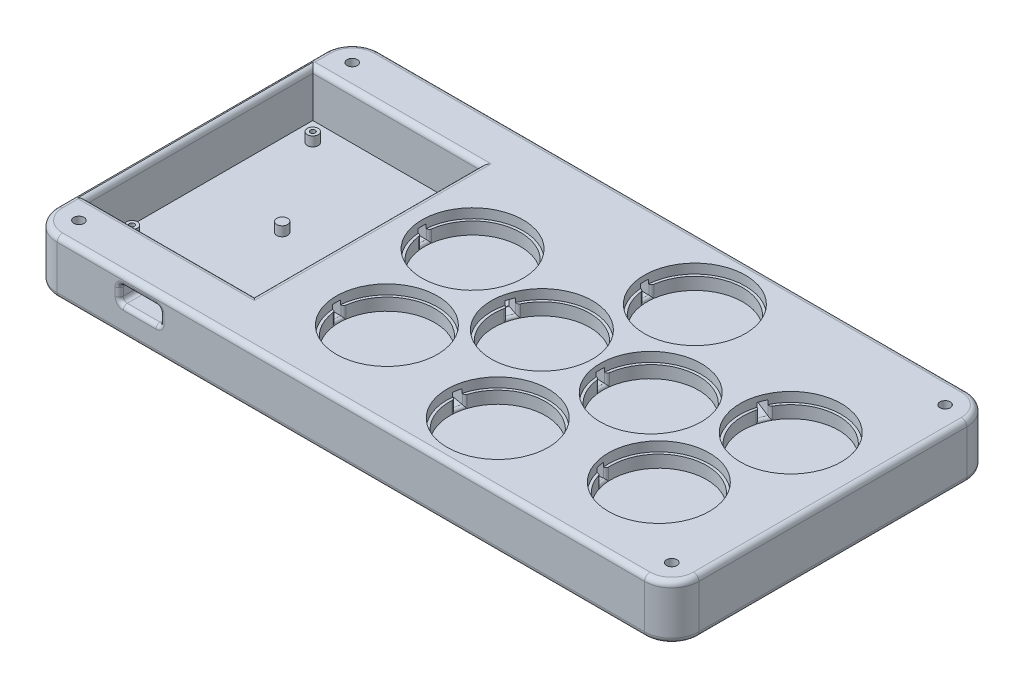
from build123d import *

# Parameters (mm, degrees)
SKETCH1_W                = 236
SKETCH1_H                = 118.5
SKETCH1_W_2              = 230
SKETCH1_H_2              = 112.5
SKETCH1_R                = 17.6
SKETCH1_W_3              = 61
SKETCH1_H_3              = 82.5
SKETCH1_W_4              = 61.6
SKETCH1_H_4              = 83.1
BOSS_EXTRUDE1_DEPTH      = 5
SKETCH1_3_W              = 236
SKETCH1_3_H              = 118.5
SKETCH1_3_W_2            = 230
SKETCH1_3_H_2            = 112.5
SKETCH1_3_R              = 17.6
SKETCH1_3_W_3            = 61.6
SKETCH1_3_H_3            = 83.1
BOSS_EXTRUDE2_DEPTH      = 15
CUT_EXTRUDE2_START       = -2
SKETCH1_5_W              = 61
SKETCH1_5_H              = 82.5
SKETCH1_5_R              = 17.6
SKETCH1_5_W_2            = 61.6
SKETCH1_5_H_2            = 83.1
CUT_EXTRUDE2_DEPTH       = 2
CUT_EXTRUDE3_DEPTH       = 1
CUT_EXTRUDE3_DEPTH_BACK  = 4
CUT_EXTRUDE4_REACH       = 219.976
SKETCH3_W                = 15
SKETCH3_H                = 6
SKETCH4_R                = 2
SKETCH4_R_2              = 0.925
BOSS_EXTRUDE3_DEPTH      = 3.5
BOSS_EXTRUDE4_DEPTH      = 7
BOSS_EXTRUDE4_DEPTH_BACK = 2
SKETCH1_6_R              = 17.6
FILLET1_R                = 1
FILLET2_R                = 1.5
SKETCH7_R                = 1.9
CUT_EXTRUDE5_DEPTH       = 6
FILLET3_R                = 10
FILLET4_R                = 2
CUT_EXTRUDE6_START       = -3.5
SKETCH8_R                = 18.6
SKETCH8_R_2              = 17.6
CUT_EXTRUDE6_DEPTH       = 3.5


# Some blends are built 0.0001 mm under size
with BuildPart() as part:
    # Sketch1 → Boss-Extrude1 (new body)
    # profile 1 of 12: a face of its own
    with BuildSketch(Plane(origin=(0, 0, 0), x_dir=(1, 0, 0), z_dir=(0, 1, 0))):
        with Locations((64.335496373, 41.57608502)):
            Rectangle(SKETCH1_W, SKETCH1_H)
        with Locations((64.335496373, 41.57608502)):
            Rectangle(SKETCH1_W_2, SKETCH1_H_2, mode=Mode.SUBTRACT)
    # profile 2 of 12: a face of its own
    with BuildSketch(Plane(origin=(0, 0, 0), x_dir=(1, 0, 0), z_dir=(0, 1, 0))):
        with Locations((64.335496373, 41.57608502)):
            Rectangle(SKETCH1_W_2, SKETCH1_H_2)
        with Locations((95.335496373, 77.82608502)):
            Circle(SKETCH1_R, mode=Mode.SUBTRACT)
        with Locations((153.835496373, 54.57608502)):
            Circle(SKETCH1_R, mode=Mode.SUBTRACT)
        with Locations((95.335496373, 5.32608502)):
            Circle(SKETCH1_R, mode=Mode.SUBTRACT)
        with Locations((115.335496373, 41.57608502)):
            Circle(SKETCH1_R, mode=Mode.SUBTRACT)
        with Locations((75.335496373, 41.57608502)):
            Circle(SKETCH1_R, mode=Mode.SUBTRACT)
        with Locations((145.335496373, 14.57608502)):
            Circle(SKETCH1_R, mode=Mode.SUBTRACT)
        with Locations((45.335496373, 14.57608502)):
            Circle(SKETCH1_R, mode=Mode.SUBTRACT)
        with Locations((36.835496373, 54.57608502)):
            Circle(SKETCH1_R, mode=Mode.SUBTRACT)
        with Locations((-19.664503627, 41.57608502)):
            Rectangle(SKETCH1_W_3, SKETCH1_H_3, mode=Mode.SUBTRACT)
    # profile 3 of 12: a face of its own
    with BuildSketch(Plane(origin=(0, 0, 0), x_dir=(1, 0, 0), z_dir=(0, 1, 0))):
        with Locations((-19.664503627, 41.57608502)):
            Rectangle(SKETCH1_W_3, SKETCH1_H_3)
    # profile 4 of 12: a face of its own
    with BuildSketch(Plane(origin=(0, 0, 0), x_dir=(1, 0, 0), z_dir=(0, 1, 0))):
        with Locations((36.835496373, 54.57608502)):
            Circle(SKETCH1_R)
    # profile 5 of 12: a face of its own
    with BuildSketch(Plane(origin=(0, 0, 0), x_dir=(1, 0, 0), z_dir=(0, 1, 0))):
        with Locations((45.335496373, 14.57608502)):
            Circle(SKETCH1_R)
    # profile 6 of 12: a face of its own
    with BuildSketch(Plane(origin=(0, 0, 0), x_dir=(1, 0, 0), z_dir=(0, 1, 0))):
        with Locations((75.335496373, 41.57608502)):
            Circle(SKETCH1_R)
    # profile 7 of 12: a face of its own
    with BuildSketch(Plane(origin=(0, 0, 0), x_dir=(1, 0, 0), z_dir=(0, 1, 0))):
        with Locations((95.335496373, 77.82608502)):
            Circle(SKETCH1_R)
    # profile 8 of 12: a face of its own
    with BuildSketch(Plane(origin=(0, 0, 0), x_dir=(1, 0, 0), z_dir=(0, 1, 0))):
        with Locations((115.335496373, 41.57608502)):
            Circle(SKETCH1_R)
    # profile 9 of 12: a face of its own
    with BuildSketch(Plane(origin=(0, 0, 0), x_dir=(1, 0, 0), z_dir=(0, 1, 0))):
        with Locations((153.835496373, 54.57608502)):
            Circle(SKETCH1_R)
    # profile 10 of 12: a face of its own
    with BuildSketch(Plane(origin=(0, 0, 0), x_dir=(1, 0, 0), z_dir=(0, 1, 0))):
        with Locations((145.335496373, 14.57608502)):
            Circle(SKETCH1_R)
    # profile 11 of 12: a face of its own
    with BuildSketch(Plane(origin=(0, 0, 0), x_dir=(1, 0, 0), z_dir=(0, 1, 0))):
        with Locations((95.335496373, 5.32608502)):
            Circle(SKETCH1_R)
    # profile 12 of 12: a face of its own
    with BuildSketch(Plane(origin=(0, 0, 0), x_dir=(1, 0, 0), z_dir=(0, 1, 0))):
        with Locations((-19.664503627, 41.57608502)):
            Rectangle(SKETCH1_W_4, SKETCH1_H_4)
    extrude(amount=-BOSS_EXTRUDE1_DEPTH)

    # Sketch1<3> → Boss-Extrude2 (add)
    # profile 1 of 2: a face of its own
    with BuildSketch(Plane(origin=(0, 0, 0), x_dir=(1, 0, 0), z_dir=(0, 1, 0))):
        with Locations((64.335496373, 41.57608502)):
            Rectangle(SKETCH1_3_W, SKETCH1_3_H)
        with Locations((64.335496373, 41.57608502)):
            Rectangle(SKETCH1_3_W_2, SKETCH1_3_H_2, mode=Mode.SUBTRACT)
    # profile 2 of 2: a face of its own
    with BuildSketch(Plane(origin=(0, 0, 0), x_dir=(1, 0, 0), z_dir=(0, 1, 0))):
        with Locations((64.335496373, 41.57608502)):
            Rectangle(SKETCH1_3_W_2, SKETCH1_3_H_2)
        with Locations(Location((95.335496373, 77.82608502, 0), (0, 0, 270))):
            Circle(SKETCH1_3_R, mode=Mode.SUBTRACT)
        with Locations(Location((153.835496373, 54.57608502, 0), (0, 0, 270))):
            Circle(SKETCH1_3_R, mode=Mode.SUBTRACT)
        with Locations(Location((95.335496373, 5.32608502, 0), (0, 0, 270))):
            Circle(SKETCH1_3_R, mode=Mode.SUBTRACT)
        with Locations(Location((115.335496373, 41.57608502, 0), (0, 0, 270))):
            Circle(SKETCH1_3_R, mode=Mode.SUBTRACT)
        with Locations(Location((75.335496373, 41.57608502, 0), (0, 0, 270))):
            Circle(SKETCH1_3_R, mode=Mode.SUBTRACT)
        with Locations(Location((145.335496373, 14.57608502, 0), (0, 0, 270))):
            Circle(SKETCH1_3_R, mode=Mode.SUBTRACT)
        with Locations(Location((45.335496373, 14.57608502, 0), (0, 0, 270))):
            Circle(SKETCH1_3_R, mode=Mode.SUBTRACT)
        with Locations(Location((36.835496373, 54.57608502, 0), (0, 0, 270))):
            Circle(SKETCH1_3_R, mode=Mode.SUBTRACT)
        with Locations((-19.664503627, 41.57608502)):
            Rectangle(SKETCH1_3_W_3, SKETCH1_3_H_3, mode=Mode.SUBTRACT)
    extrude(amount=BOSS_EXTRUDE2_DEPTH)

    # Sketch1<5> → Cut-Extrude2 (cut)
    with BuildSketch(Plane(origin=(0, 0, 0), x_dir=(1, 0, 0), z_dir=(0, 1, 0)).offset(CUT_EXTRUDE2_START)):
        with Locations((-19.664503627, 41.57608502)):
            Rectangle(SKETCH1_5_W, SKETCH1_5_H)
        with Locations(Location((36.835496373, 54.57608502, 0), (0, 0, 270))):
            Circle(SKETCH1_5_R)
        with Locations(Location((45.335496373, 14.57608502, 0), (0, 0, 270))):
            Circle(SKETCH1_5_R)
        with Locations(Location((75.335496373, 41.57608502, 0), (0, 0, 270))):
            Circle(SKETCH1_5_R)
        with Locations(Location((95.335496373, 77.82608502, 0), (0, 0, 270))):
            Circle(SKETCH1_5_R)
        with Locations(Location((115.335496373, 41.57608502, 0), (0, 0, 270))):
            Circle(SKETCH1_5_R)
        with Locations(Location((153.835496373, 54.57608502, 0), (0, 0, 270))):
            Circle(SKETCH1_5_R)
        with Locations(Location((145.335496373, 14.57608502, 0), (0, 0, 270))):
            Circle(SKETCH1_5_R)
        with Locations(Location((95.335496373, 5.32608502, 0), (0, 0, 270))):
            Circle(SKETCH1_5_R)
        with Locations((-19.664503627, 41.57608502)):
            Rectangle(SKETCH1_5_W_2, SKETCH1_5_H_2)
    extrude(amount=CUT_EXTRUDE2_DEPTH, mode=Mode.SUBTRACT)

    # Sketch2 → Cut-Extrude3 (cut, two sides: drawn at the far end of the back side and taken through both)
    with BuildSketch(Plane(origin=(0, 12, 0), x_dir=(1, 0, 0), z_dir=(0, 1, 0)).offset(-CUT_EXTRUDE3_DEPTH_BACK)):
        with BuildLine():
            Line((11.135496373, 79.32608502), (11.135496373, 76.32608502))
            Line((11.135496373, 76.32608502), (77.799533325, 76.32608502))
            ThreePointArc((77.799533325, 76.32608502), (77.735496373, 77.82608502), (77.799533325, 79.32608502))
            Line((77.799533325, 79.32608502), (11.135496373, 79.32608502))
        make_face()
        with BuildLine():
            ThreePointArc((19.299533325, 53.07608502), (19.235496373, 54.57608502), (19.299533325, 56.07608502))
            Line((19.299533325, 56.07608502), (11.135496373, 56.07608502))
            Line((11.135496373, 56.07608502), (11.135496373, 53.07608502))
            Line((11.135496373, 53.07608502), (19.299533325, 53.07608502))
        make_face()
        with BuildLine():
            Line((59.200999236, 48.607301283), (53.929743667, 50.38720576))
            ThreePointArc((53.929743667, 50.38720576), (53.510540122, 48.945550767), (52.96999351, 47.544868758))
            Line((52.96999351, 47.544868758), (58.241249079, 45.76496428))
            ThreePointArc((58.241249079, 45.76496428), (58.660452624, 47.206619273), (59.200999236, 48.607301283))
        make_face()
        with BuildLine():
            Line((97.799533325, 43.07608502), (92.87145942, 43.07608502))
            ThreePointArc((92.87145942, 43.07608502), (92.919479847, 42.326768164), (92.935496373, 41.57608502))
            ThreePointArc((92.935496373, 41.57608502), (92.919479847, 40.825401876), (92.87145942, 40.07608502))
            Line((92.87145942, 40.07608502), (97.799533325, 40.07608502))
            ThreePointArc((97.799533325, 40.07608502), (97.735496373, 41.57608502), (97.799533325, 43.07608502))
        make_face()
        with BuildLine():
            ThreePointArc((112.185601477, 72.743373343), (111.691107335, 71.325778099), (111.077594615, 69.955485111))
            Line((111.077594615, 69.955485111), (136.985391269, 59.658796697))
            ThreePointArc((136.985391269, 59.658796697), (137.479885411, 61.076391941), (138.093398131, 62.446684929))
            Line((138.093398131, 62.446684929), (112.185601477, 72.743373343))
        make_face()
        with BuildLine():
            Line((127.819258216, 12.861033763), (112.305994931, 9.991080055))
            ThreePointArc((112.305994931, 9.991080055), (112.641833201, 8.527757333), (112.85173453, 7.041136278))
            Line((112.85173453, 7.041136278), (128.364997814, 9.911089985))
            ThreePointArc((128.364997814, 9.911089985), (128.029159545, 11.374412707), (127.819258216, 12.861033763))
        make_face()
        with BuildLine():
            Line((78.364997814, 9.991080055), (62.85173453, 12.861033763))
            ThreePointArc((62.85173453, 12.861033763), (62.641833201, 11.374412707), (62.305994931, 9.911089985))
            Line((62.305994931, 9.911089985), (77.819258216, 7.041136278))
            ThreePointArc((77.819258216, 7.041136278), (78.029159545, 8.527757333), (78.364997814, 9.991080055))
        make_face()
        with BuildLine():
            Line((27.799533325, 16.07608502), (11.135496373, 16.07608502))
            Line((11.135496373, 16.07608502), (11.135496373, 13.07608502))
            Line((11.135496373, 13.07608502), (27.799533325, 13.07608502))
            ThreePointArc((27.799533325, 13.07608502), (27.735496373, 14.57608502), (27.799533325, 16.07608502))
        make_face()
    extrude(amount=CUT_EXTRUDE3_DEPTH + CUT_EXTRUDE3_DEPTH_BACK, mode=Mode.SUBTRACT)

    # Sketch3 → Cut-Extrude4 (cut, up to next)
    with BuildSketch(Plane.XY.offset(17.67391498), mode=Mode.PRIVATE) as cut_extrude4_sk1:
        with Locations((-13.364503627, 8)):
            Rectangle(SKETCH3_W, SKETCH3_H)
    cut_extrude4_tool1 = extrude(cut_extrude4_sk1.sketch, amount=-CUT_EXTRUDE4_REACH, mode=Mode.PRIVATE) & part.part
    add(cut_extrude4_tool1.solids().sort_by_distance((-13.364504, 8, 17.673915))[0], mode=Mode.SUBTRACT)

    # Sketch4 → Boss-Extrude3 (add)
    # profile 1 of 5: a face of its own
    with BuildSketch(Plane(origin=(0, -2, 0), x_dir=(1, 0, 0), z_dir=(0, 1, 0))):
        with Locations(Location((-43.464503627, 76.12608502, 0), (0, 0, 270))):
            Circle(SKETCH4_R)
        with Locations(Location((-43.464503627, 76.12608502, 0), (0, 0, 270))):
            Circle(SKETCH4_R_2, mode=Mode.SUBTRACT)
    # profile 2 of 5: a face of its own
    with BuildSketch(Plane(origin=(0, -2, 0), x_dir=(1, 0, 0), z_dir=(0, 1, 0))):
        with Locations(Location((4.135496373, 76.12608502, 0), (0, 0, 270))):
            Circle(SKETCH4_R)
        with Locations(Location((4.135496373, 76.12608502, 0), (0, 0, 270))):
            Circle(SKETCH4_R_2, mode=Mode.SUBTRACT)
    # profile 3 of 5: a face of its own
    with BuildSketch(Plane(origin=(0, -2, 0), x_dir=(1, 0, 0), z_dir=(0, 1, 0))):
        with Locations(Location((-46.964503627, 13.12608502, 0), (0, 0, 270))):
            Circle(SKETCH4_R)
        with Locations(Location((-46.964503627, 13.12608502, 0), (0, 0, 270))):
            Circle(SKETCH4_R_2, mode=Mode.SUBTRACT)
    # profile 4 of 5: a face of its own
    with BuildSketch(Plane(origin=(0, -2, 0), x_dir=(1, 0, 0), z_dir=(0, 1, 0))):
        with Locations(Location((3.135496373, 7.02608502, 0), (0, 0, 270))):
            Circle(SKETCH4_R)
    # profile 5 of 5: a face of its own
    with BuildSketch(Plane(origin=(0, -2, 0), x_dir=(1, 0, 0), z_dir=(0, 1, 0))):
        with Locations(Location((-20.464503627, 41.87608502, 0), (0, 0, 270))):
            Circle(SKETCH4_R)
    extrude(amount=BOSS_EXTRUDE3_DEPTH)

    # Sketch1<6> → Boss-Extrude4 (add, two sides: drawn at the far end of the back side and taken through both)
    with BuildSketch(Plane(origin=(0, 0, 0), x_dir=(1, 0, 0), z_dir=(0, 1, 0)).offset(-BOSS_EXTRUDE4_DEPTH_BACK)):
        with Locations(Location((36.835496373, 54.57608502, 0), (0, 0, 270))):
            Circle(SKETCH1_6_R)
        with Locations(Location((75.335496373, 41.57608502, 0), (0, 0, 270))):
            Circle(SKETCH1_6_R)
        with Locations(Location((95.335496373, 77.82608502, 0), (0, 0, 270))):
            Circle(SKETCH1_6_R)
        with Locations(Location((115.335496373, 41.57608502, 0), (0, 0, 270))):
            Circle(SKETCH1_6_R)
        with Locations(Location((95.335496373, 5.32608502, 0), (0, 0, 270))):
            Circle(SKETCH1_6_R)
        with Locations(Location((45.335496373, 14.57608502, 0), (0, 0, 270))):
            Circle(SKETCH1_6_R)
        with Locations(Location((153.835496373, 54.57608502, 0), (0, 0, 270))):
            Circle(SKETCH1_6_R)
        with Locations(Location((145.335496373, 14.57608502, 0), (0, 0, 270))):
            Circle(SKETCH1_6_R)
    extrude(amount=BOSS_EXTRUDE4_DEPTH + BOSS_EXTRUDE4_DEPTH_BACK)

    # Fillet1
    fillet1_edges = [part.edges().sort_by_distance(p)[0] for p in [
        (53.929743667, 10.5, -50.38720576),
        (53.510540122, 13, -48.945550767),
        (52.96999351, 10.5, -47.544868758),
        (58.241249079, 10.5, -45.76496428),
        (58.660452624, 13, -47.206619273),
        (59.200999236, 10.5, -48.607301283),
        (53.510540122, 8, -48.945550767),
        (58.660452624, 8, -47.206619273),
        (19.299533325, 10.5, -56.07608502),
        (19.235496373, 13, -54.57608502),
        (19.299533325, 10.5, -53.07608502),
        (11.135496373, 10.5, -53.07608502),
        (11.135496373, 13, -54.57608502),
        (11.135496373, 10.5, -56.07608502),
        (19.235496373, 8, -54.57608502),
        (11.135496373, 8, -54.57608502),
        (111.077594615, 10.5, -69.955485111),
        (111.691107335, 13, -71.325778099),
        (112.185601477, 10.5, -72.743373343),
        (138.093398131, 10.5, -62.446684929),
        (137.479885411, 13, -61.076391941),
        (136.985391269, 10.5, -59.658796697),
        (111.691107335, 8, -71.325778099),
        (137.479885411, 8, -61.076391941),
        (27.799533325, 10.5, -16.07608502),
        (27.735496373, 13, -14.57608502),
        (27.799533325, 10.5, -13.07608502),
        (11.135496373, 10.5, -13.07608502),
        (11.135496373, 13, -14.57608502),
        (11.135496373, 10.5, -16.07608502),
        (27.735496373, 8, -14.57608502),
        (11.135496373, 8, -14.57608502),
        (92.87145942, 10.5, -43.07608502),
        (92.935496373, 13, -41.57608502),
        (92.87145942, 10.5, -40.07608502),
        (97.799533325, 10.5, -40.07608502),
        (97.735496373, 13, -41.57608502),
        (97.799533325, 10.5, -43.07608502),
        (92.935496373, 8, -41.57608502),
        (97.735496373, 8, -41.57608502),
        (112.305994931, 10.5, -9.991080055),
        (112.641833201, 13, -8.527757333),
        (112.85173453, 10.5, -7.041136278),
        (128.364997814, 10.5, -9.911089985),
        (128.029159545, 13, -11.374412707),
        (127.819258216, 10.5, -12.861033763),
        (112.641833201, 8, -8.527757333),
        (128.029159545, 8, -11.374412707),
        (62.305994931, 10.5, -9.911089985),
        (62.641833201, 13, -11.374412707),
        (62.85173453, 10.5, -12.861033763),
        (78.364997814, 10.5, -9.991080055),
        (78.029159545, 13, -8.527757333),
        (77.819258216, 10.5, -7.041136278),
        (62.641833201, 8, -11.374412707),
        (78.029159545, 8, -8.527757333),
        (77.799533325, 10.5, -76.32608502),
        (77.735496373, 13, -77.82608502),
        (77.799533325, 10.5, -79.32608502),
        (11.135496373, 10.5, -79.32608502),
        (11.135496373, 13, -77.82608502),
        (11.135496373, 10.5, -76.32608502),
        (77.735496373, 8, -77.82608502),
        (11.135496373, 8, -77.82608502),
    ]]
    fillet(fillet1_edges, radius=FILLET1_R - 0.0001)  # a hair under: the kernel refuses the full size

    # Fillet2
    fillet2_edges = [part.edges().sort_by_distance(p)[0] for p in [
        (-20.864503627, 8, 17.67391498),
        (-13.364503627, 5, 17.67391498),
        (-13.364503627, 5, -0.02608502),
        (-5.864503627, 5, 8.82391498),
        (-5.864503627, 11, 8.82391498),
        (-5.864503627, 8, 17.67391498),
        (-20.864503627, 11, 8.82391498),
        (-13.364503627, 11, 17.67391498),
        (-20.864503627, 8, -0.02608502),
        (-20.864503627, 5, 8.82391498),
        (-13.364503627, 11, -0.02608502),
        (-5.864503627, 8, -0.02608502),
    ]]
    fillet(fillet2_edges, radius=FILLET2_R)

    # Sketch7 → Cut-Extrude5 (cut)
    with BuildSketch(Plane(origin=(0, 15, 0), x_dir=(1, 0, 0), z_dir=(0, 1, 0))):
        with Locations(Location((-44.664503627, -8.67391498, 0), (0, 0, 270))):
            Circle(SKETCH7_R)
        with Locations(Location((-44.664503627, 91.82608502, 0), (0, 0, 90))):
            Circle(SKETCH7_R)
        with Locations(Location((173.335496373, -8.67391498, 0), (0, 0, 90))):
            Circle(SKETCH7_R)
        with Locations(Location((173.335496373, 91.82608502, 0), (0, 0, 270))):
            Circle(SKETCH7_R)
    extrude(amount=-CUT_EXTRUDE5_DEPTH, mode=Mode.SUBTRACT)

    # Fillet3
    fillet3_edges = [part.edges().sort_by_distance(p)[0] for p in [
        (182.335496373, 5, -100.82608502),
        (182.335496373, 5, 17.67391498),
        (-53.664503627, 5, 17.67391498),
        (-53.664503627, 5, -100.82608502),
    ]]
    fillet(fillet3_edges, radius=FILLET3_R)

    # Fillet4
    # the kernel refuses this fillet: 2 mm, written as the material it takes off along each edge
    with BuildSketch(Plane(origin=(-43.664503627, -5, 7.67391498), x_dir=(-1, 0, 0), z_dir=(0, 0, -1))) as fillet4_piece_1:
        with BuildLine():
            CenterArc((10 - FILLET4_R, FILLET4_R), FILLET4_R, 270, 90)
            Line((10 - FILLET4_R, 0), (10 - FILLET4_R, -FILLET4_R * 0.02))
            Line((10 - FILLET4_R, -FILLET4_R * 0.02), (10 + FILLET4_R * 0.02, -FILLET4_R * 0.02))
            Line((10 + FILLET4_R * 0.02, -FILLET4_R * 0.02), (10 + FILLET4_R * 0.02, FILLET4_R))
            Line((10 + FILLET4_R * 0.02, FILLET4_R), (10, FILLET4_R))
        make_face()
    revolve(axis=Axis((-43.664503627, -5, 7.67391498), (0, 1, 0)), revolution_arc=90, mode=Mode.SUBTRACT)
    with BuildSketch(Plane(origin=(-53.664503627, -5, 7.67391498), x_dir=(0, 1, 0), z_dir=(0, 0, -1)), Plane(origin=(182.335496373, -5, -90.82608502), x_dir=(0, 1, 0), z_dir=(0, 0, 1)), Plane(origin=(-53.664503627, 15, 7.67391498), x_dir=(1, 0, 0), z_dir=(0, 0, -1)), Plane(origin=(182.335496373, 15, -90.82608502), x_dir=(-1, 0, 0), z_dir=(0, 0, 1))) as fillet4_piece_2:
        with BuildLine():
            CenterArc((FILLET4_R, FILLET4_R), FILLET4_R, 180, 90)
            Line((0, FILLET4_R), (-FILLET4_R * 0.02, FILLET4_R))
            Line((-FILLET4_R * 0.02, FILLET4_R), (-FILLET4_R * 0.02, -FILLET4_R * 0.02))
            Line((-FILLET4_R * 0.02, -FILLET4_R * 0.02), (FILLET4_R, -FILLET4_R * 0.02))
            Line((FILLET4_R, -FILLET4_R * 0.02), (FILLET4_R, 0))
        make_face()
    extrude(amount=98.5, mode=Mode.SUBTRACT)
    with BuildSketch(Plane(origin=(-43.664503627, -5, -90.82608502), x_dir=(0, 0, -1), z_dir=(1, 0, 0))) as fillet4_piece_3:
        with BuildLine():
            CenterArc((10 - FILLET4_R, FILLET4_R), FILLET4_R, 270, 90)
            Line((10 - FILLET4_R, 0), (10 - FILLET4_R, -FILLET4_R * 0.02))
            Line((10 - FILLET4_R, -FILLET4_R * 0.02), (10 + FILLET4_R * 0.02, -FILLET4_R * 0.02))
            Line((10 + FILLET4_R * 0.02, -FILLET4_R * 0.02), (10 + FILLET4_R * 0.02, FILLET4_R))
            Line((10 + FILLET4_R * 0.02, FILLET4_R), (10, FILLET4_R))
        make_face()
    revolve(axis=Axis((-43.664503627, -5, -90.82608502), (0, 1, 0)), revolution_arc=90, mode=Mode.SUBTRACT)
    with BuildSketch(Plane(origin=(-43.664503627, -5, -100.82608502), x_dir=(0, 1, 0), z_dir=(1, 0, 0)), Plane(origin=(-43.664503627, 15, -100.82608502), x_dir=(0, 0, 1), z_dir=(1, 0, 0)), Plane(origin=(172.335496373, -5, 17.67391498), x_dir=(0, 1, 0), z_dir=(-1, 0, 0)), Plane(origin=(172.335496373, 15, 17.67391498), x_dir=(0, 0, -1), z_dir=(-1, 0, 0))) as fillet4_piece_4:
        with BuildLine():
            CenterArc((FILLET4_R, FILLET4_R), FILLET4_R, 180, 90)
            Line((0, FILLET4_R), (-FILLET4_R * 0.02, FILLET4_R))
            Line((-FILLET4_R * 0.02, FILLET4_R), (-FILLET4_R * 0.02, -FILLET4_R * 0.02))
            Line((-FILLET4_R * 0.02, -FILLET4_R * 0.02), (FILLET4_R, -FILLET4_R * 0.02))
            Line((FILLET4_R, -FILLET4_R * 0.02), (FILLET4_R, 0))
        make_face()
    extrude(amount=216, mode=Mode.SUBTRACT)
    with BuildSketch(Plane(origin=(172.335496373, -5, -90.82608502), x_dir=(0, 0, -1), z_dir=(-1, 0, 0))) as fillet4_piece_5:
        with BuildLine():
            CenterArc((10 - FILLET4_R, -FILLET4_R), FILLET4_R, 0, 90)
            Line((10 - FILLET4_R, 0), (10 - FILLET4_R, FILLET4_R * 0.02))
            Line((10 - FILLET4_R, FILLET4_R * 0.02), (10 + FILLET4_R * 0.02, FILLET4_R * 0.02))
            Line((10 + FILLET4_R * 0.02, FILLET4_R * 0.02), (10 + FILLET4_R * 0.02, -FILLET4_R))
            Line((10 + FILLET4_R * 0.02, -FILLET4_R), (10, -FILLET4_R))
        make_face()
    revolve(axis=Axis((172.335496373, -5, -90.82608502), (0, -1, 0)), revolution_arc=90, mode=Mode.SUBTRACT)
    with BuildSketch(Plane(origin=(172.335496373, -5, 7.67391498), x_dir=(1, 0, 0), z_dir=(0, 0, -1))) as fillet4_piece_6:
        with BuildLine():
            CenterArc((10 - FILLET4_R, -FILLET4_R), FILLET4_R, 0, 90)
            Line((10 - FILLET4_R, 0), (10 - FILLET4_R, FILLET4_R * 0.02))
            Line((10 - FILLET4_R, FILLET4_R * 0.02), (10 + FILLET4_R * 0.02, FILLET4_R * 0.02))
            Line((10 + FILLET4_R * 0.02, FILLET4_R * 0.02), (10 + FILLET4_R * 0.02, -FILLET4_R))
            Line((10 + FILLET4_R * 0.02, -FILLET4_R), (10, -FILLET4_R))
        make_face()
    revolve(axis=Axis((172.335496373, -5, 7.67391498), (0, -1, 0)), revolution_arc=90, mode=Mode.SUBTRACT)
    with BuildSketch(Plane(origin=(-43.664503627, 15, 7.67391498), x_dir=(-1, 0, 0), z_dir=(0, 0, -1))) as fillet4_piece_7:
        with BuildLine():
            CenterArc((10 - FILLET4_R, -FILLET4_R), FILLET4_R, 0, 90)
            Line((10, -FILLET4_R), (10 + FILLET4_R * 0.02, -FILLET4_R))
            Line((10 + FILLET4_R * 0.02, -FILLET4_R), (10 + FILLET4_R * 0.02, FILLET4_R * 0.02))
            Line((10 + FILLET4_R * 0.02, FILLET4_R * 0.02), (10 - FILLET4_R, FILLET4_R * 0.02))
            Line((10 - FILLET4_R, FILLET4_R * 0.02), (10 - FILLET4_R, 0))
        make_face()
    revolve(axis=Axis((-43.664503627, 15, 7.67391498), (0, 1, 0)), revolution_arc=90, mode=Mode.SUBTRACT)
    with BuildSketch(Plane(origin=(-43.664503627, 15, -90.82608502), x_dir=(0, 0, -1), z_dir=(1, 0, 0))) as fillet4_piece_8:
        with BuildLine():
            CenterArc((10 - FILLET4_R, -FILLET4_R), FILLET4_R, 0, 90)
            Line((10, -FILLET4_R), (10 + FILLET4_R * 0.02, -FILLET4_R))
            Line((10 + FILLET4_R * 0.02, -FILLET4_R), (10 + FILLET4_R * 0.02, FILLET4_R * 0.02))
            Line((10 + FILLET4_R * 0.02, FILLET4_R * 0.02), (10 - FILLET4_R, FILLET4_R * 0.02))
            Line((10 - FILLET4_R, FILLET4_R * 0.02), (10 - FILLET4_R, 0))
        make_face()
    revolve(axis=Axis((-43.664503627, 15, -90.82608502), (0, 1, 0)), revolution_arc=90, mode=Mode.SUBTRACT)
    with BuildSketch(Plane(origin=(172.335496373, 15, -90.82608502), x_dir=(0, 0, -1), z_dir=(-1, 0, 0))) as fillet4_piece_9:
        with BuildLine():
            CenterArc((10 - FILLET4_R, FILLET4_R), FILLET4_R, 270, 90)
            Line((10, FILLET4_R), (10 + FILLET4_R * 0.02, FILLET4_R))
            Line((10 + FILLET4_R * 0.02, FILLET4_R), (10 + FILLET4_R * 0.02, -FILLET4_R * 0.02))
            Line((10 + FILLET4_R * 0.02, -FILLET4_R * 0.02), (10 - FILLET4_R, -FILLET4_R * 0.02))
            Line((10 - FILLET4_R, -FILLET4_R * 0.02), (10 - FILLET4_R, 0))
        make_face()
    revolve(axis=Axis((172.335496373, 15, -90.82608502), (0, -1, 0)), revolution_arc=90, mode=Mode.SUBTRACT)
    with BuildSketch(Plane(origin=(172.335496373, 15, 7.67391498), x_dir=(1, 0, 0), z_dir=(0, 0, -1))) as fillet4_piece_10:
        with BuildLine():
            CenterArc((10 - FILLET4_R, FILLET4_R), FILLET4_R, 270, 90)
            Line((10, FILLET4_R), (10 + FILLET4_R * 0.02, FILLET4_R))
            Line((10 + FILLET4_R * 0.02, FILLET4_R), (10 + FILLET4_R * 0.02, -FILLET4_R * 0.02))
            Line((10 + FILLET4_R * 0.02, -FILLET4_R * 0.02), (10 - FILLET4_R, -FILLET4_R * 0.02))
            Line((10 - FILLET4_R, -FILLET4_R * 0.02), (10 - FILLET4_R, 0))
        make_face()
    revolve(axis=Axis((172.335496373, 15, 7.67391498), (0, -1, 0)), revolution_arc=90, mode=Mode.SUBTRACT)
    with BuildSketch(Plane(origin=(-50.464503627, 15, -83.12608502), x_dir=(-1, 0, 0), z_dir=(0, 0, 1)), Plane(origin=(11.135496373, 15, -0.02608502), x_dir=(1, 0, 0), z_dir=(0, 0, -1))) as fillet4_piece_11:
        with BuildLine():
            CenterArc((FILLET4_R, FILLET4_R), FILLET4_R, 180, 90)
            Line((0, FILLET4_R), (-FILLET4_R * 0.02, FILLET4_R))
            Line((-FILLET4_R * 0.02, FILLET4_R), (-FILLET4_R * 0.02, -FILLET4_R * 0.02))
            Line((-FILLET4_R * 0.02, -FILLET4_R * 0.02), (FILLET4_R, -FILLET4_R * 0.02))
            Line((FILLET4_R, -FILLET4_R * 0.02), (FILLET4_R, 0))
        make_face()
    extrude(amount=83.1, mode=Mode.SUBTRACT)
    with BuildSketch(Plane(origin=(-50.464503627, 15, -0.02608502), x_dir=(0, 0, 1), z_dir=(1, 0, 0)), Plane(origin=(11.135496373, 15, -83.12608502), x_dir=(0, 0, -1), z_dir=(-1, 0, 0))) as fillet4_piece_12:
        with BuildLine():
            CenterArc((FILLET4_R, FILLET4_R), FILLET4_R, 180, 90)
            Line((0, FILLET4_R), (-FILLET4_R * 0.02, FILLET4_R))
            Line((-FILLET4_R * 0.02, FILLET4_R), (-FILLET4_R * 0.02, -FILLET4_R * 0.02))
            Line((-FILLET4_R * 0.02, -FILLET4_R * 0.02), (FILLET4_R, -FILLET4_R * 0.02))
            Line((FILLET4_R, -FILLET4_R * 0.02), (FILLET4_R, 0))
        make_face()
    extrude(amount=61.6, mode=Mode.SUBTRACT)
    with BuildSketch(Plane(origin=(-50.464503627, 15, -88.12608502), x_dir=(-1, 0, 0), z_dir=(0, 0, 1))) as fillet4_piece_13a_section:
        with BuildLine():
            CenterArc((FILLET4_R, FILLET4_R), FILLET4_R, 180, 90)
            Line((0, FILLET4_R), (-FILLET4_R * 0.02, FILLET4_R))
            Line((-FILLET4_R * 0.02, FILLET4_R), (-FILLET4_R * 0.02, -FILLET4_R * 0.02))
            Line((-FILLET4_R * 0.02, -FILLET4_R * 0.02), (FILLET4_R, -FILLET4_R * 0.02))
            Line((FILLET4_R, -FILLET4_R * 0.02), (FILLET4_R, 0))
        make_face()
    fillet4_piece_13a = extrude(amount=88.1, mode=Mode.PRIVATE)
    fillet4_piece_13a = split(fillet4_piece_13a, bisect_by=Plane(origin=(-50.464503627, 15, -83.12608502), z_dir=(0, 0, -1)), keep=Keep.TOP, mode=Mode.PRIVATE)
    with BuildSketch(Plane(origin=(11.135496373, 15, -83.12608502), x_dir=(0, 0, -1), z_dir=(-1, 0, 0))) as fillet4_piece_13b_section:
        with BuildLine():
            CenterArc((FILLET4_R, FILLET4_R), FILLET4_R, 180, 90)
            Line((0, FILLET4_R), (-FILLET4_R * 0.02, FILLET4_R))
            Line((-FILLET4_R * 0.02, FILLET4_R), (-FILLET4_R * 0.02, -FILLET4_R * 0.02))
            Line((-FILLET4_R * 0.02, -FILLET4_R * 0.02), (FILLET4_R, -FILLET4_R * 0.02))
            Line((FILLET4_R, -FILLET4_R * 0.02), (FILLET4_R, 0))
        make_face()
    fillet4_piece_13b = extrude(amount=66.6, mode=Mode.PRIVATE)
    fillet4_piece_13b = split(fillet4_piece_13b, bisect_by=Plane(origin=(-50.464503627, 15, -83.12608502), z_dir=(-1, 0, 0)), keep=Keep.TOP, mode=Mode.PRIVATE)
    fillet4_piece_13 = fillet4_piece_13a & fillet4_piece_13b
    add(fillet4_piece_13, mode=Mode.SUBTRACT)
    with BuildSketch(Plane(origin=(-55.464503627, 15, -0.02608502), x_dir=(0, 0, 1), z_dir=(1, 0, 0))) as fillet4_piece_14a_section:
        with BuildLine():
            CenterArc((FILLET4_R, FILLET4_R), FILLET4_R, 180, 90)
            Line((0, FILLET4_R), (-FILLET4_R * 0.02, FILLET4_R))
            Line((-FILLET4_R * 0.02, FILLET4_R), (-FILLET4_R * 0.02, -FILLET4_R * 0.02))
            Line((-FILLET4_R * 0.02, -FILLET4_R * 0.02), (FILLET4_R, -FILLET4_R * 0.02))
            Line((FILLET4_R, -FILLET4_R * 0.02), (FILLET4_R, 0))
        make_face()
    fillet4_piece_14a = extrude(amount=66.6, mode=Mode.PRIVATE)
    fillet4_piece_14a = split(fillet4_piece_14a, bisect_by=Plane(origin=(-50.464503627, 15, -0.02608502), z_dir=(-1, 0, 0)), keep=Keep.TOP, mode=Mode.PRIVATE)
    with BuildSketch(Plane(origin=(-50.464503627, 15, -83.12608502), x_dir=(-1, 0, 0), z_dir=(0, 0, 1))) as fillet4_piece_14b_section:
        with BuildLine():
            CenterArc((FILLET4_R, FILLET4_R), FILLET4_R, 180, 90)
            Line((0, FILLET4_R), (-FILLET4_R * 0.02, FILLET4_R))
            Line((-FILLET4_R * 0.02, FILLET4_R), (-FILLET4_R * 0.02, -FILLET4_R * 0.02))
            Line((-FILLET4_R * 0.02, -FILLET4_R * 0.02), (FILLET4_R, -FILLET4_R * 0.02))
            Line((FILLET4_R, -FILLET4_R * 0.02), (FILLET4_R, 0))
        make_face()
    fillet4_piece_14b = extrude(amount=88.1, mode=Mode.PRIVATE)
    fillet4_piece_14b = split(fillet4_piece_14b, bisect_by=Plane(origin=(-50.464503627, 15, -0.02608502), z_dir=(0, 0, 1)), keep=Keep.TOP, mode=Mode.PRIVATE)
    fillet4_piece_14 = fillet4_piece_14a & fillet4_piece_14b
    add(fillet4_piece_14, mode=Mode.SUBTRACT)
    with BuildSketch(Plane(origin=(-50.464503627, 15, -0.02608502), x_dir=(0, 0, 1), z_dir=(1, 0, 0))) as fillet4_piece_15a_section:
        with BuildLine():
            CenterArc((FILLET4_R, FILLET4_R), FILLET4_R, 180, 90)
            Line((0, FILLET4_R), (-FILLET4_R * 0.02, FILLET4_R))
            Line((-FILLET4_R * 0.02, FILLET4_R), (-FILLET4_R * 0.02, -FILLET4_R * 0.02))
            Line((-FILLET4_R * 0.02, -FILLET4_R * 0.02), (FILLET4_R, -FILLET4_R * 0.02))
            Line((FILLET4_R, -FILLET4_R * 0.02), (FILLET4_R, 0))
        make_face()
    fillet4_piece_15a = extrude(amount=66.6, mode=Mode.PRIVATE)
    fillet4_piece_15a = split(fillet4_piece_15a, bisect_by=Plane(origin=(11.135496373, 15, -0.02608502), z_dir=(1, 0, 0)), keep=Keep.TOP, mode=Mode.PRIVATE)
    with BuildSketch(Plane(origin=(11.135496373, 15, 4.97391498), x_dir=(1, 0, 0), z_dir=(0, 0, -1))) as fillet4_piece_15b_section:
        with BuildLine():
            CenterArc((FILLET4_R, FILLET4_R), FILLET4_R, 180, 90)
            Line((0, FILLET4_R), (-FILLET4_R * 0.02, FILLET4_R))
            Line((-FILLET4_R * 0.02, FILLET4_R), (-FILLET4_R * 0.02, -FILLET4_R * 0.02))
            Line((-FILLET4_R * 0.02, -FILLET4_R * 0.02), (FILLET4_R, -FILLET4_R * 0.02))
            Line((FILLET4_R, -FILLET4_R * 0.02), (FILLET4_R, 0))
        make_face()
    fillet4_piece_15b = extrude(amount=88.1, mode=Mode.PRIVATE)
    fillet4_piece_15b = split(fillet4_piece_15b, bisect_by=Plane(origin=(11.135496373, 15, -0.02608502), z_dir=(0, 0, 1)), keep=Keep.TOP, mode=Mode.PRIVATE)
    fillet4_piece_15 = fillet4_piece_15a & fillet4_piece_15b
    add(fillet4_piece_15, mode=Mode.SUBTRACT)
    with BuildSketch(Plane(origin=(11.135496373, 15, -0.02608502), x_dir=(1, 0, 0), z_dir=(0, 0, -1))) as fillet4_piece_16a_section:
        with BuildLine():
            CenterArc((FILLET4_R, FILLET4_R), FILLET4_R, 180, 90)
            Line((0, FILLET4_R), (-FILLET4_R * 0.02, FILLET4_R))
            Line((-FILLET4_R * 0.02, FILLET4_R), (-FILLET4_R * 0.02, -FILLET4_R * 0.02))
            Line((-FILLET4_R * 0.02, -FILLET4_R * 0.02), (FILLET4_R, -FILLET4_R * 0.02))
            Line((FILLET4_R, -FILLET4_R * 0.02), (FILLET4_R, 0))
        make_face()
    fillet4_piece_16a = extrude(amount=88.1, mode=Mode.PRIVATE)
    fillet4_piece_16a = split(fillet4_piece_16a, bisect_by=Plane(origin=(11.135496373, 15, -83.12608502), z_dir=(0, 0, -1)), keep=Keep.TOP, mode=Mode.PRIVATE)
    with BuildSketch(Plane(origin=(16.135496373, 15, -83.12608502), x_dir=(0, 0, -1), z_dir=(-1, 0, 0))) as fillet4_piece_16b_section:
        with BuildLine():
            CenterArc((FILLET4_R, FILLET4_R), FILLET4_R, 180, 90)
            Line((0, FILLET4_R), (-FILLET4_R * 0.02, FILLET4_R))
            Line((-FILLET4_R * 0.02, FILLET4_R), (-FILLET4_R * 0.02, -FILLET4_R * 0.02))
            Line((-FILLET4_R * 0.02, -FILLET4_R * 0.02), (FILLET4_R, -FILLET4_R * 0.02))
            Line((FILLET4_R, -FILLET4_R * 0.02), (FILLET4_R, 0))
        make_face()
    fillet4_piece_16b = extrude(amount=66.6, mode=Mode.PRIVATE)
    fillet4_piece_16b = split(fillet4_piece_16b, bisect_by=Plane(origin=(11.135496373, 15, -83.12608502), z_dir=(1, 0, 0)), keep=Keep.TOP, mode=Mode.PRIVATE)
    fillet4_piece_16 = fillet4_piece_16a & fillet4_piece_16b
    add(fillet4_piece_16, mode=Mode.SUBTRACT)

    # Sketch8 → Cut-Extrude6 (cut)
    # profile 1 of 8: a face of its own
    with BuildSketch(Plane(origin=(0, 15, 0), x_dir=(1, 0, 0), z_dir=(0, 1, 0)).offset(CUT_EXTRUDE6_START)):
        with Locations(Location((36.835496373, 54.57608502, 0), (0, 0, 270))):
            Circle(SKETCH8_R)
        with Locations((36.835496373, 54.57608502)):
            Circle(SKETCH8_R_2, mode=Mode.SUBTRACT)
    # profile 2 of 8: a face of its own
    with BuildSketch(Plane(origin=(0, 15, 0), x_dir=(1, 0, 0), z_dir=(0, 1, 0)).offset(CUT_EXTRUDE6_START)):
        with Locations(Location((75.335496373, 41.57608502, 0), (0, 0, 270))):
            Circle(SKETCH8_R)
        with Locations((75.335496373, 41.57608502)):
            Circle(SKETCH8_R_2, mode=Mode.SUBTRACT)
    # profile 3 of 8: a face of its own
    with BuildSketch(Plane(origin=(0, 15, 0), x_dir=(1, 0, 0), z_dir=(0, 1, 0)).offset(CUT_EXTRUDE6_START)):
        with Locations(Location((95.335496373, 5.32608502, 0), (0, 0, 270))):
            Circle(SKETCH8_R)
        with Locations((95.335496373, 5.32608502)):
            Circle(SKETCH8_R_2, mode=Mode.SUBTRACT)
    # profile 4 of 8: a face of its own
    with BuildSketch(Plane(origin=(0, 15, 0), x_dir=(1, 0, 0), z_dir=(0, 1, 0)).offset(CUT_EXTRUDE6_START)):
        with Locations(Location((145.335496373, 14.57608502, 0), (0, 0, 270))):
            Circle(SKETCH8_R)
        with Locations((145.335496373, 14.57608502)):
            Circle(SKETCH8_R_2, mode=Mode.SUBTRACT)
    # profile 5 of 8: a face of its own
    with BuildSketch(Plane(origin=(0, 15, 0), x_dir=(1, 0, 0), z_dir=(0, 1, 0)).offset(CUT_EXTRUDE6_START)):
        with Locations(Location((45.335496373, 14.57608502, 0), (0, 0, 270))):
            Circle(SKETCH8_R)
        with Locations((45.335496373, 14.57608502)):
            Circle(SKETCH8_R_2, mode=Mode.SUBTRACT)
    # profile 6 of 8: a face of its own
    with BuildSketch(Plane(origin=(0, 15, 0), x_dir=(1, 0, 0), z_dir=(0, 1, 0)).offset(CUT_EXTRUDE6_START)):
        with Locations(Location((115.335496373, 41.57608502, 0), (0, 0, 270))):
            Circle(SKETCH8_R)
        with Locations((115.335496373, 41.57608502)):
            Circle(SKETCH8_R_2, mode=Mode.SUBTRACT)
    # profile 7 of 8: a face of its own
    with BuildSketch(Plane(origin=(0, 15, 0), x_dir=(1, 0, 0), z_dir=(0, 1, 0)).offset(CUT_EXTRUDE6_START)):
        with Locations(Location((153.835496373, 54.57608502, 0), (0, 0, 270))):
            Circle(SKETCH8_R)
        with Locations((153.835496373, 54.57608502)):
            Circle(SKETCH8_R_2, mode=Mode.SUBTRACT)
    # profile 8 of 8: a face of its own
    with BuildSketch(Plane(origin=(0, 15, 0), x_dir=(1, 0, 0), z_dir=(0, 1, 0)).offset(CUT_EXTRUDE6_START)):
        with Locations(Location((95.335496373, 77.82608502, 0), (0, 0, 270))):
            Circle(SKETCH8_R)
        with Locations((95.335496373, 77.82608502)):
            Circle(SKETCH8_R_2, mode=Mode.SUBTRACT)
    extrude(amount=CUT_EXTRUDE6_DEPTH, mode=Mode.SUBTRACT)


solid = part.part
